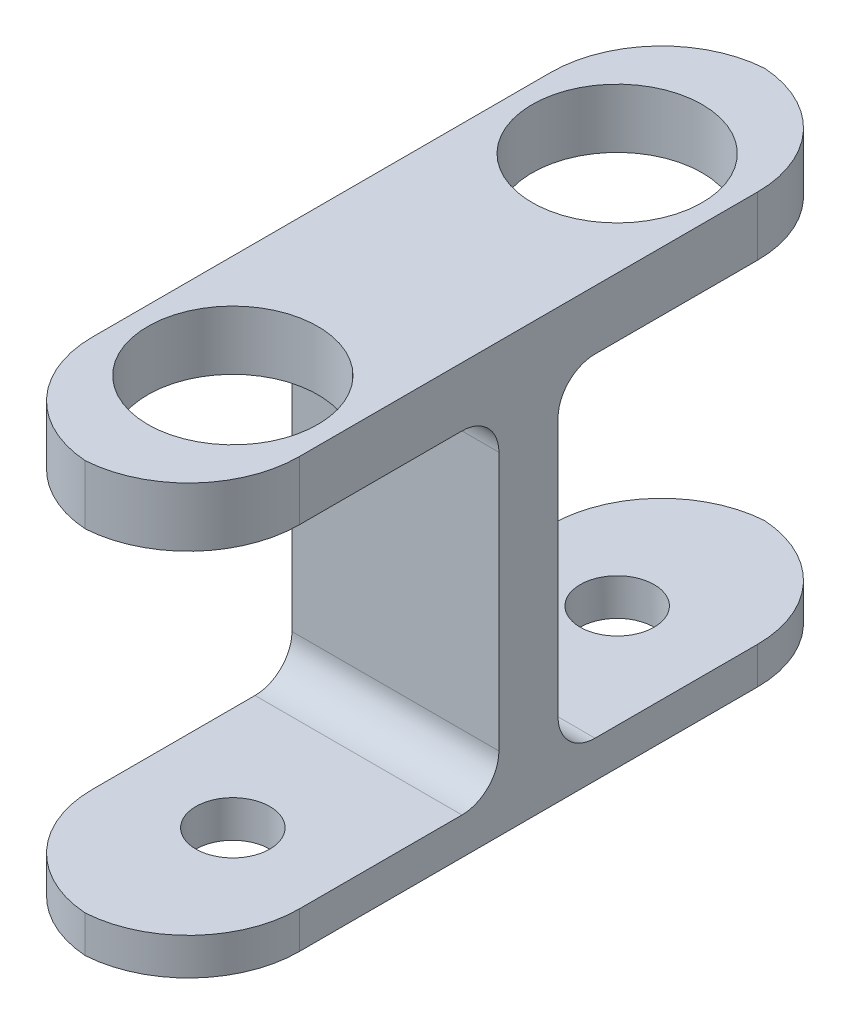
from build123d import *

# Parameters (mm, degrees)
BOSS_EXTRUDE1_DEPTH  = 28
CUT_EXTRUDE1_REACH   = 81.145
SKETCH2_R            = 11.5
CUT_EXTRUDE2_REACH   = 77.558
SKETCH3_R            = 5
FILLET2_R            = 5
FILLET2_OF_MIRROR2_R = 5
FILLET3_R            = 15


with BuildPart() as part:
    # Sketch1 → Boss-Extrude1 (new body)
    with BuildSketch(Plane(origin=(0, 0, 0), x_dir=(0, 0, -1), z_dir=(1, 0, 0))):
        Polygon((0, 0), (42, 0), (42, -45), (0, -45), (0, -50), (46, -50), (46, 8), (0, 8), align=None)
    boss_extrude1 = extrude(amount=BOSS_EXTRUDE1_DEPTH)

    # Sketch2 → Cut-Extrude1 (cut, up to next)
    with BuildSketch(Plane(origin=(0, 8, 0), x_dir=(1, 0, 0), z_dir=(0, 1, 0)), mode=Mode.PRIVATE) as cut_extrude1_sk1:
        with Locations(Location((14, 20, 0), (0, 0, 270))):
            Circle(SKETCH2_R)
    cut_extrude1_tool1 = extrude(cut_extrude1_sk1.sketch, amount=-CUT_EXTRUDE1_REACH, mode=Mode.PRIVATE) & part.part
    cut_extrude1 = cut_extrude1_tool1.solids().sort_by_distance((14, 8, -20))[0]
    add(cut_extrude1, mode=Mode.SUBTRACT)

    # Sketch3 → Cut-Extrude2 (cut, up to next)
    with BuildSketch(Plane(origin=(0, -45, 0), x_dir=(1, 0, 0), z_dir=(0, 1, 0)), mode=Mode.PRIVATE) as cut_extrude2_sk1:
        with Locations(Location((14, 20, 0), (0, 0, 270))):
            Circle(SKETCH3_R)
    cut_extrude2_tool1 = extrude(cut_extrude2_sk1.sketch, amount=-CUT_EXTRUDE2_REACH, mode=Mode.PRIVATE) & part.part
    cut_extrude2 = cut_extrude2_tool1.solids().sort_by_distance((14, -45, -20))[0]
    add(cut_extrude2, mode=Mode.SUBTRACT)

    # Fillet2
    fillet2_edges = [part.edges().sort_by_distance(p)[0] for p in [
        (14, -45, -42),
        (14, 0, -42),
    ]]
    fillet(fillet2_edges, radius=FILLET2_R)

    # Mirror2: Boss-Extrude1, Cut-Extrude1, Cut-Extrude2 across plane
    add(boss_extrude1.mirror(Plane(origin=(28, -50, -46), x_dir=(1, 0, 0), z_dir=(0, 0, 1))))
    add(cut_extrude1.mirror(Plane(origin=(28, -50, -46), x_dir=(1, 0, 0), z_dir=(0, 0, 1))), mode=Mode.SUBTRACT)
    add(cut_extrude2.mirror(Plane(origin=(28, -50, -46), x_dir=(1, 0, 0), z_dir=(0, 0, 1))), mode=Mode.SUBTRACT)

    # Fillet2 of Mirror2
    fillet2_of_mirror2_edges = [part.edges().sort_by_distance(p)[0] for p in [
        (14, -45, -50),
        (14, 0, -50),
    ]]
    fillet(fillet2_of_mirror2_edges, radius=FILLET2_OF_MIRROR2_R)

    # Fillet3
    # the kernel refuses this fillet: 15 mm, written as the material it takes off along each edge
    with BuildSketch(Plane(origin=(0, -7.5, 0), x_dir=(0, 0, -1), z_dir=(0, -1, 0)), Plane(origin=(28, -7.5, 0), x_dir=(-1, 0, 0), z_dir=(0, -1, 0))) as fillet3_piece_1:
        with BuildLine():
            CenterArc((FILLET3_R, FILLET3_R), FILLET3_R, 180, 90)
            Line((0, FILLET3_R), (0, 0))
            Line((0, 0), (FILLET3_R, 0))
        make_face()
    extrude(amount=80, mode=Mode.SUBTRACT)
    with BuildSketch(Plane(origin=(0, 45.5, 0), x_dir=(0, 0, -1), z_dir=(0, -1, 0)), Plane(origin=(28, 45.5, 0), x_dir=(-1, 0, 0), z_dir=(0, -1, 0))) as fillet3_piece_2:
        with BuildLine():
            CenterArc((FILLET3_R, FILLET3_R), FILLET3_R, 180, 90)
            Line((0, FILLET3_R), (0, 0))
            Line((0, 0), (FILLET3_R, 0))
        make_face()
    extrude(amount=83, mode=Mode.SUBTRACT)
    with BuildSketch(Plane(origin=(0, 45.5, -92), x_dir=(0, 0, 1), z_dir=(0, -1, 0)), Plane(origin=(28, 45.5, -92), x_dir=(-1, 0, 0), z_dir=(0, -1, 0))) as fillet3_piece_3:
        with BuildLine():
            CenterArc((FILLET3_R, -FILLET3_R), FILLET3_R, 90, 90)
            Line((0, -FILLET3_R), (0, 0))
            Line((0, 0), (FILLET3_R, 0))
        make_face()
    extrude(amount=83, mode=Mode.SUBTRACT)
    with BuildSketch(Plane(origin=(0, -7.5, -92), x_dir=(0, 0, 1), z_dir=(0, -1, 0)), Plane(origin=(28, -7.5, -92), x_dir=(-1, 0, 0), z_dir=(0, -1, 0))) as fillet3_piece_4:
        with BuildLine():
            CenterArc((FILLET3_R, -FILLET3_R), FILLET3_R, 90, 90)
            Line((0, -FILLET3_R), (0, 0))
            Line((0, 0), (FILLET3_R, 0))
        make_face()
    extrude(amount=80, mode=Mode.SUBTRACT)


solid = part.part
